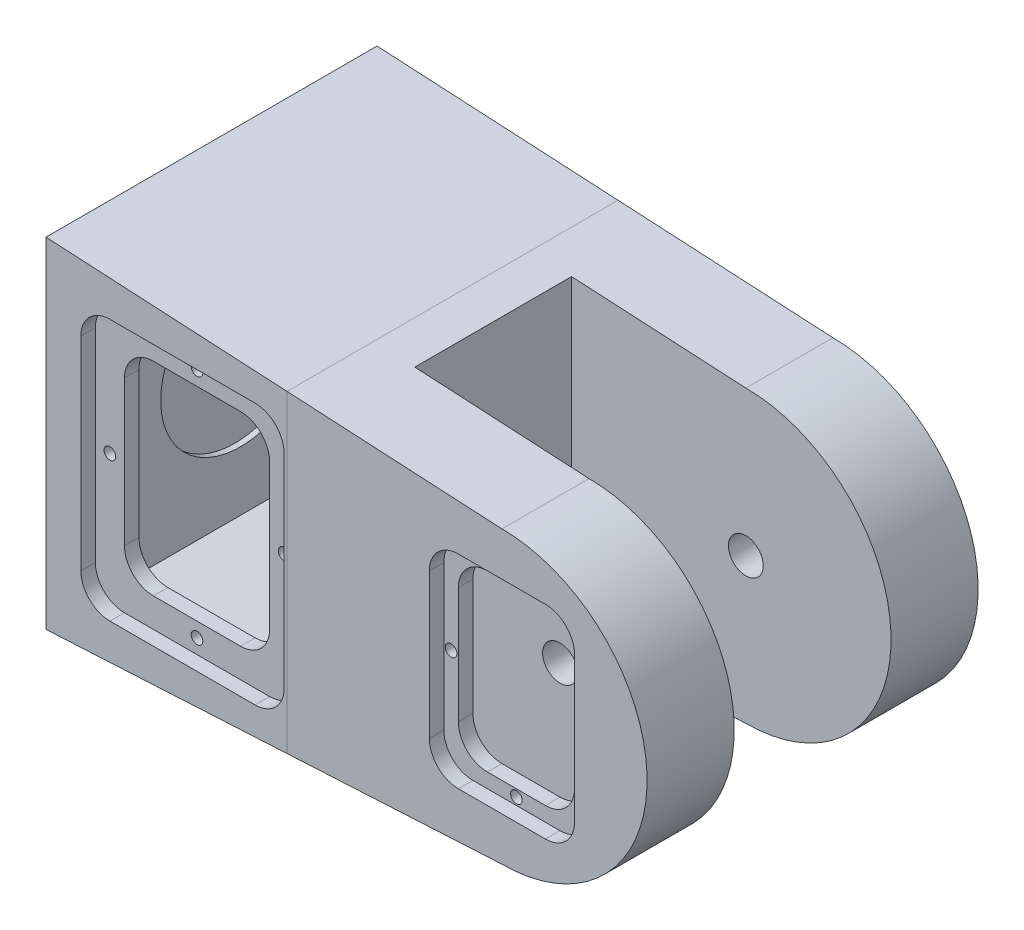
from build123d import *

# Parameters (mm, degrees)
RESSALTO_EXTRUS_O1_DEPTH   = 57
ESBO_O2_R                  = 37.5
RESSALTO_EXTRUS_O2_DEPTH   = 2
CORTE_EXTRUS_O1_DEPTH      = 179.751923067
CORTE_EXTRUS_O1_DEPTH_BACK = 179.751923067
ESBO_O3_W                  = 110
ESBO_O3_H                  = 54
CASCA2_START               = -47
CASCA2_DEPTH               = 94
CASCA2_2_DEPTH             = 10
CASCA2_START_2             = 37
CASCA2_3_DEPTH             = 10
CASCA2_START_3             = -149
CASCA2_4_OUTLINE_R         = 27.5
CASCA2_4_DEPTH             = 2
CORTE_EXTRUS_O2_DEPTH      = 20
CORTE_EXTRUS_O3_DEPTH      = 5
ESBO_O6_R                  = 2
CORTE_EXTRUS_O4_DEPTH      = 5
ESBO_O7_R                  = 6
CORTE_EXTRUS_O5_DEPTH      = 15
CORTE_EXTRUS_O6_DEPTH      = 10
CORTE_EXTRUS_O7_DEPTH      = 5
ESBO_O10_R                 = 2
CORTE_EXTRUS_O8_DEPTH      = 5
ESBO_O11_R                 = 6
CORTE_EXTRUS_O9_DEPTH      = 75


with BuildPart() as part:
    # Esboço1 → Ressalto-extrusão1 (new, symmetric)
    with BuildSketch(Plane.XY):
        with BuildLine():
            Line((-157, -58.5), (-157, 58.5))
            Line((-157, 58.5), (0, 50))
            ThreePointArc((0, 50), (50, 0), (0, -50))
            Line((0, -50), (-157, -58.5))
        make_face()
    extrude(amount=RESSALTO_EXTRUS_O1_DEPTH, both=True)

    # Esboço2 → Ressalto-extrusão2 (add)
    with BuildSketch(Plane.ZY.offset(157)):
        Circle(ESBO_O2_R)
    extrude(amount=RESSALTO_EXTRUS_O2_DEPTH)

    # Esboço3 → Corte-extrusão1 (cut, two sides: drawn at the far end of the back side and taken through both)
    with BuildSketch(Plane(origin=(0, 0, 0), x_dir=(1, 0, 0), z_dir=(0, 1, 0)).offset(-CORTE_EXTRUS_O1_DEPTH_BACK)):
        with Locations((-5, 0)):
            Rectangle(ESBO_O3_W, ESBO_O3_H)
    extrude(amount=CORTE_EXTRUS_O1_DEPTH + CORTE_EXTRUS_O1_DEPTH_BACK, mode=Mode.SUBTRACT)

    # Casca2: read off the stored shape, not the designer's step
    # Casca2 outline → Casca2 (cut)
    with BuildSketch(Plane.XY.offset(CASCA2_START)):
        Polygon((-70, -43.775163874), (-70, 43.775163874), (-147, 47.943953683), (-147, -47.943953683), align=None)
    extrude(amount=CASCA2_DEPTH, mode=Mode.SUBTRACT)

    # Casca2 2 outline → Casca2 2 (cut)
    with BuildSketch(Plane.XY.offset(CASCA2_START)):
        with BuildLine():
            ThreePointArc((-0.255437699, -39.999184386), (40, 0), (-0.255437699, 39.999184386))
            Line((-0.255437699, 39.999184386), (-70, 43.775163874))
            Line((-70, 43.775163874), (-70, -43.775163874))
            Line((-70, -43.775163874), (-0.255437699, -39.999184386))
        make_face()
    extrude(amount=CASCA2_2_DEPTH, mode=Mode.SUBTRACT)

    # Casca2 3 outline → Casca2 3 (cut)
    with BuildSketch(Plane.XY.offset(CASCA2_START_2)):
        with BuildLine():
            ThreePointArc((-0.255437699, -39.999184386), (40, 0), (-0.255437699, 39.999184386))
            Line((-0.255437699, 39.999184386), (-70, 43.775163874))
            Line((-70, 43.775163874), (-70, -43.775163874))
            Line((-70, -43.775163874), (-0.255437699, -39.999184386))
        make_face()
    extrude(amount=CASCA2_3_DEPTH, mode=Mode.SUBTRACT)

    # Casca2 4 outline → Casca2 4 (cut)
    with BuildSketch(Plane.YZ.offset(CASCA2_START_3)):
        Circle(CASCA2_4_OUTLINE_R)
    extrude(amount=CASCA2_4_DEPTH, mode=Mode.SUBTRACT)

    # Esboço4 → Corte-extrusão2 (cut)
    with BuildSketch(Plane.XY.offset(57)):
        with BuildLine():
            Line((-95, -35), (-125, -35))
            ThreePointArc((-125, -35), (-132.071067812, -32.071067812), (-135, -25))
            Line((-135, -25), (-135, 25))
            ThreePointArc((-135, 25), (-132.071067812, 32.071067812), (-125, 35))
            Line((-125, 35), (-95, 35))
            ThreePointArc((-95, 35), (-87.928932188, 32.071067812), (-85, 25))
            Line((-85, 25), (-85, -25))
            ThreePointArc((-85, -25), (-87.928932188, -32.071067812), (-95, -35))
        make_face()
    extrude(amount=-CORTE_EXTRUS_O2_DEPTH, mode=Mode.SUBTRACT)

    # Esboço5 → Corte-extrusão3 (cut)
    with BuildSketch(Plane.XY.offset(57)):
        with BuildLine():
            Line((-85, -45), (-135, -45))
            ThreePointArc((-135, -45), (-142.071067812, -42.071067812), (-145, -35))
            Line((-145, -35), (-145, 35))
            ThreePointArc((-145, 35), (-142.071067812, 42.071067812), (-135, 45))
            Line((-135, 45), (-85, 45))
            ThreePointArc((-85, 45), (-77.928932188, 42.071067812), (-75, 35))
            Line((-75, 35), (-75, -35))
            ThreePointArc((-75, -35), (-77.928932188, -42.071067812), (-85, -45))
        make_face()
    extrude(amount=-CORTE_EXTRUS_O3_DEPTH, mode=Mode.SUBTRACT)

    # Esboço6 → Corte-extrusão4 (cut)
    with BuildSketch(Plane.XY.offset(52)):
        with Locations((-110, 40)):
            Circle(ESBO_O6_R)
        with Locations((-140, 0)):
            Circle(ESBO_O6_R)
        with Locations(Location((-110, -40, 0), (0, 0, 180))):
            Circle(ESBO_O6_R)
        with Locations(Location((-80, 0, 0), (0, 0, 180))):
            Circle(ESBO_O6_R)
    extrude(amount=-CORTE_EXTRUS_O4_DEPTH, mode=Mode.SUBTRACT)

    # Esboço7 → Corte-extrusão5 (cut)
    with BuildSketch(Plane.ZY.offset(159)):
        Circle(ESBO_O7_R)
    extrude(amount=-CORTE_EXTRUS_O5_DEPTH, mode=Mode.SUBTRACT)

    # Esboço8 → Corte-extrusão6 (cut)
    with BuildSketch(Plane.XY.offset(57)):
        with BuildLine():
            Line((10, -30), (-10, -30))
            ThreePointArc((-10, -30), (-17.071067812, -27.071067812), (-20, -20))
            Line((-20, -20), (-20, 20))
            ThreePointArc((-20, 20), (-17.071067812, 27.071067812), (-10, 30))
            Line((-10, 30), (10, 30))
            ThreePointArc((10, 30), (17.071067812, 27.071067812), (20, 20))
            Line((20, 20), (20, -20))
            ThreePointArc((20, -20), (17.071067812, -27.071067812), (10, -30))
        make_face()
    corte_extrus_o6 = extrude(amount=-CORTE_EXTRUS_O6_DEPTH, mode=Mode.SUBTRACT)

    # Esboço9 → Corte-extrusão7 (cut)
    with BuildSketch(Plane.XY.offset(57)):
        with BuildLine():
            Line((15, -35), (-15, -35))
            ThreePointArc((-15, -35), (-22.071067812, -32.071067812), (-25, -25))
            Line((-25, -25), (-25, 25))
            ThreePointArc((-25, 25), (-22.071067812, 32.071067812), (-15, 35))
            Line((-15, 35), (15, 35))
            ThreePointArc((15, 35), (22.071067812, 32.071067812), (25, 25))
            Line((25, 25), (25, -25))
            ThreePointArc((25, -25), (22.071067812, -32.071067812), (15, -35))
        make_face()
    corte_extrus_o7 = extrude(amount=-CORTE_EXTRUS_O7_DEPTH, mode=Mode.SUBTRACT)

    # Esboço10 → Corte-extrusão8 (cut)
    with BuildSketch(Plane.XY.offset(52)):
        with Locations((0, 32.5)):
            Circle(ESBO_O10_R)
        with Locations((22.5, 0)):
            Circle(ESBO_O10_R)
        with Locations(Location((0, -32.5, 0), (0, 0, 180))):
            Circle(ESBO_O10_R)
        with Locations(Location((-22.5, 0, 0), (0, 0, 180))):
            Circle(ESBO_O10_R)
    corte_extrus_o8 = extrude(amount=-CORTE_EXTRUS_O8_DEPTH, mode=Mode.SUBTRACT)

    # Espelhar1: Corte-extrusão6, Corte-extrusão7, Corte-extrusão8 across plane
    add(corte_extrus_o6.mirror(Plane.XY), mode=Mode.SUBTRACT)
    add(corte_extrus_o7.mirror(Plane.XY), mode=Mode.SUBTRACT)
    add(corte_extrus_o8.mirror(Plane.XY), mode=Mode.SUBTRACT)

    # Esboço11 → Corte-extrusão9 (cut)
    with BuildSketch(Plane(origin=(0, 0, -37), x_dir=(-1, 0, 0), z_dir=(0, 0, -1))):
        with Locations(Location((0, 0, 0), (0, 0, 180))):
            Circle(ESBO_O11_R)
    extrude(amount=-CORTE_EXTRUS_O9_DEPTH, mode=Mode.SUBTRACT)


with BuildPart() as body_2:
    # Dividir3: the piece on the far side of the plane
    add(part.part)
    split(bisect_by=Plane(origin=(-74, 0, 0), x_dir=(0, 0, -1), z_dir=(-1, 0, 0)), keep=Keep.BOTTOM)


with BuildPart() as part_1:
    add(part.part)

    # Dividir3
    split(bisect_by=Plane(origin=(-74, 0, 0), x_dir=(0, 0, -1), z_dir=(-1, 0, 0)), keep=Keep.TOP)


solid = Compound([body_2.part, part_1.part])
